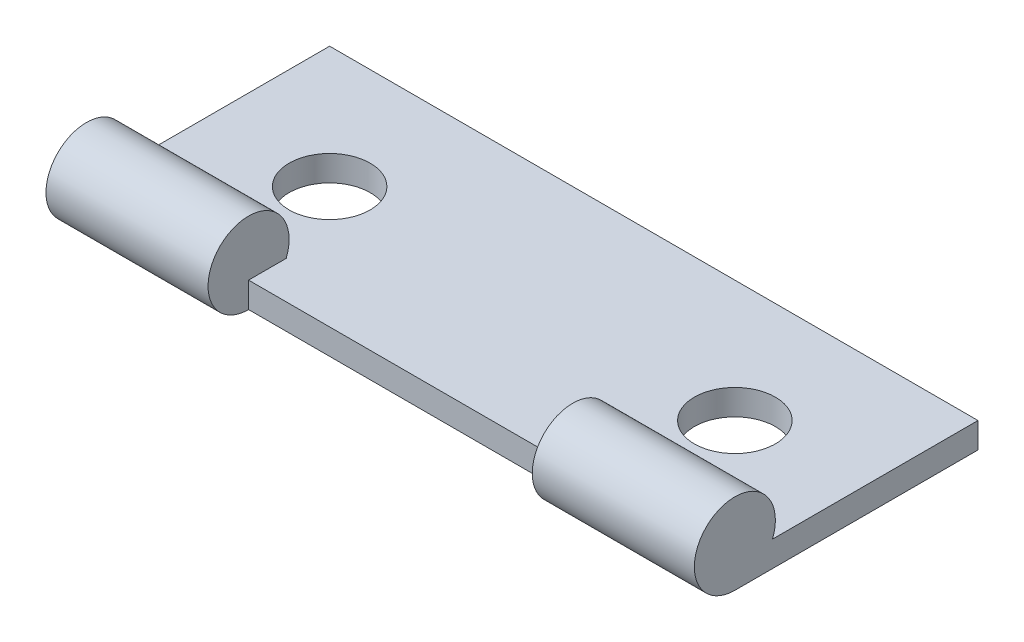
from build123d import *

# Parameters (mm, degrees)
SKETCH1_W           = 25.4
SKETCH1_H           = 9.525
SKETCH1_R           = 1.5875
BOSS_EXTRUDE1_DEPTH = 1
SKETCH2_R           = 1.5875
BOSS_EXTRUDE2_DEPTH = 6.35
LPATTERN1_COUNT     = 2
LPATTERN1_PITCH     = 19.05


with BuildPart() as part:
    # Sketch1 → Boss-Extrude1 (new body)
    with BuildSketch(Plane(origin=(0, 0, 0), x_dir=(1, 0, 0), z_dir=(0, 1, 0))):
        with Locations((12.7, 4.7625)):
            Rectangle(SKETCH1_W, SKETCH1_H)
        with Locations((4.7625, 4.7625)):
            Circle(SKETCH1_R, mode=Mode.SUBTRACT)
        with Locations((20.6375, 4.7625)):
            Circle(SKETCH1_R, mode=Mode.SUBTRACT)
    extrude(amount=BOSS_EXTRUDE1_DEPTH)

    # Sketch2 → Boss-Extrude2 (add)
    with BuildSketch(Plane.ZY):
        with Locations((0, 1.5875)):
            Circle(SKETCH2_R)
    boss_extrude2 = extrude(amount=-BOSS_EXTRUDE2_DEPTH)

    # LPattern1: Boss-Extrude2 ×2
    with Locations(*[(i * LPATTERN1_PITCH, 0, 0) for i in range(1, LPATTERN1_COUNT)]):
        add(boss_extrude2)


solid = part.part
